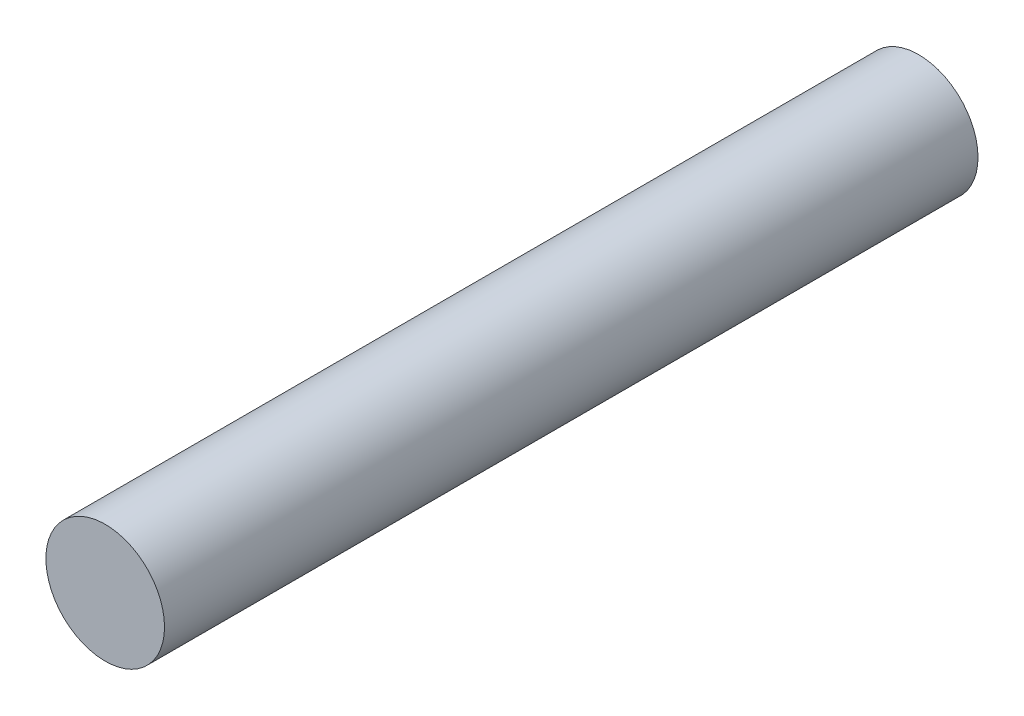
from build123d import *

# Parameters (mm, degrees)
SKETCH1_R           = 0.875
BOSS_EXTRUDE1_DEPTH = 12


with BuildPart() as part:
    # Sketch1 → Boss-Extrude1 (new body)
    with BuildSketch(Plane.XY):
        with Locations((-3.25, -0.25)):
            Circle(SKETCH1_R)
    extrude(amount=BOSS_EXTRUDE1_DEPTH)


solid = part.part
